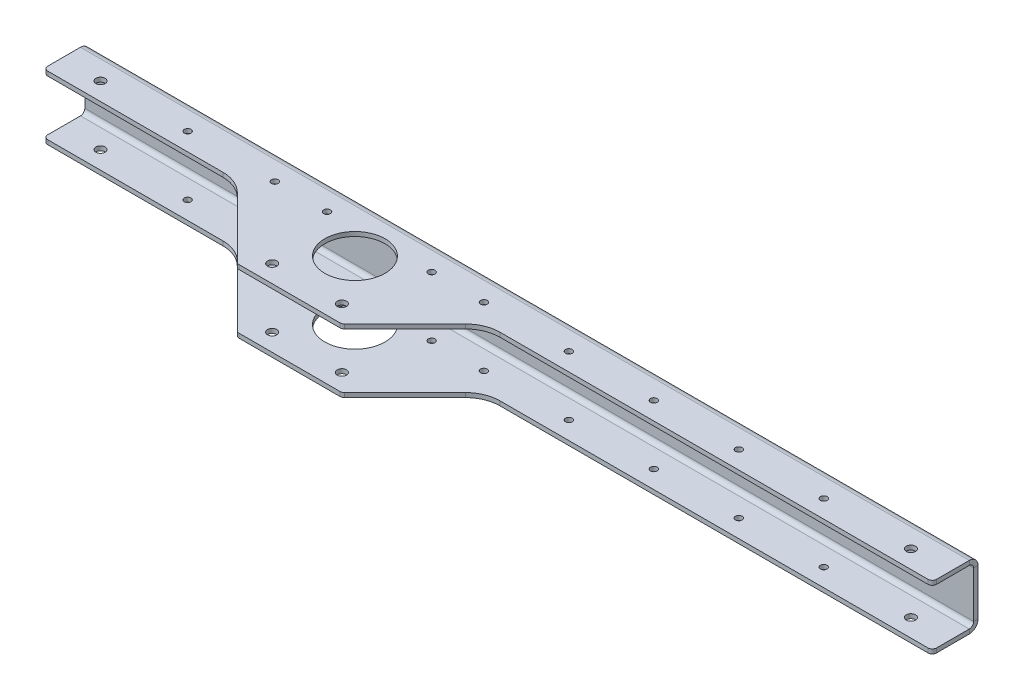
from build123d import *

# Parameters (mm, degrees)
BASE_FLANGE1_DEPTH = 647.7
SKETCH6_R          = 21.9075
CUT_EXTRUDE1_DEPTH = 655.999726679
CUT_EXTRUDE2_DEPTH = 655.999726679
SKETCH8_R          = 3.3782
SKETCH8_R_2        = 2.4257
CUT_EXTRUDE3_DEPTH = 655.999726679
SKETCH9_R          = 3.3782
CUT_EXTRUDE4_DEPTH = 655.999726679
FILLET1_R          = 25.4
FILLET2_R          = 3.175


# Sheet-metal steps are written as plain solids
with BuildPart() as part:
    # Sketch1 → Base-Flange1 (new body)
    with BuildSketch(Plane(origin=(0, 0, 0), x_dir=(0, 0, -1), z_dir=(1, 0, 0))):
        with BuildLine():
            Line((0, 0), (79.375, 0))
            ThreePointArc((79.375, 0), (81.62006403, 0.92993597), (82.55, 3.175))
            Line((82.55, 3.175), (82.55, 36.957))
            ThreePointArc((82.55, 36.957), (81.62006403, 39.20206403), (79.375, 40.132))
            Line((79.375, 40.132), (0, 40.132))
            Line((0, 40.132), (0, 43.307))
            Line((0, 43.307), (79.375, 43.307))
            ThreePointArc((79.375, 43.307), (83.865128061, 41.447128061), (85.725, 36.957))
            Line((85.725, 36.957), (85.725, 3.175))
            ThreePointArc((85.725, 3.175), (83.865128061, -1.315128061), (79.375, -3.175))
            Line((79.375, -3.175), (0, -3.175))
            Line((0, -3.175), (0, 0))
        make_face()
    extrude(amount=BASE_FLANGE1_DEPTH)

    # Sketch6 → Cut-Extrude1 (cut, through all)
    with BuildSketch(Plane(origin=(0, 43.307, 0), x_dir=(1, 0, 0), z_dir=(0, 1, 0))):
        with Locations(Location((231.775, 47.625, 0), (0, 0, 270))):
            Circle(SKETCH6_R)
    extrude(amount=-CUT_EXTRUDE1_DEPTH, mode=Mode.SUBTRACT)

    # Sketch7 → Cut-Extrude2 (cut, through all)
    with BuildSketch(Plane(origin=(0, 43.307, 0), x_dir=(1, 0, 0), z_dir=(0, 1, 0))):
        Polygon((141.2748, 52.4002), (0, 52.4002), (0, 0), (193.675, 0), align=None)
        Polygon((322.2752, 52.4002), (269.875, 0), (647.7, 0), (647.7, 52.4002), align=None)
    extrude(amount=-CUT_EXTRUDE2_DEPTH, mode=Mode.SUBTRACT)

    # Sketch8 → Cut-Extrude3 (cut, through all)
    with BuildSketch(Plane(origin=(0, 43.307, 0), x_dir=(1, 0, 0), z_dir=(0, 1, 0))):
        with Locations(Location((28.575, 65.405, 0), (0, 0, 270))):
            Circle(SKETCH8_R)
        with Locations(Location((92.075, 65.405, 0), (0, 0, 270))):
            Circle(SKETCH8_R_2)
        with Locations(Location((193.675, 65.405, 0), (0, 0, 270))):
            Circle(SKETCH8_R_2)
        with Locations(Location((269.875, 65.405, 0), (0, 0, 270))):
            Circle(SKETCH8_R_2)
        with Locations(Location((555.625, 65.405, 0), (0, 0, 270))):
            Circle(SKETCH8_R_2)
        with Locations(Location((619.125, 65.405, 0), (0, 0, 270))):
            Circle(SKETCH8_R)
        with Locations(Location((155.575, 65.405, 0), (0, 0, 270))):
            Circle(SKETCH8_R_2)
        with Locations(Location((307.975, 65.405, 0), (0, 0, 270))):
            Circle(SKETCH8_R_2)
        with Locations(Location((493.7125, 65.405, 0), (0, 0, 270))):
            Circle(SKETCH8_R_2)
        with Locations(Location((431.8, 65.405, 0), (0, 0, 270))):
            Circle(SKETCH8_R_2)
        with Locations(Location((369.8875, 65.405, 0), (0, 0, 270))):
            Circle(SKETCH8_R_2)
    extrude(amount=-CUT_EXTRUDE3_DEPTH, mode=Mode.SUBTRACT)

    # Sketch9 → Cut-Extrude4 (cut, through all)
    with BuildSketch(Plane(origin=(0, 43.307, 0), x_dir=(1, 0, 0), z_dir=(0, 1, 0))):
        with Locations(Location((257.175, 12.7, 0), (0, 0, 270))):
            Circle(SKETCH9_R)
        with Locations(Location((206.375, 12.7, 0), (0, 0, 270))):
            Circle(SKETCH9_R)
    extrude(amount=-CUT_EXTRUDE4_DEPTH, mode=Mode.SUBTRACT)

    # Fillet1
    fillet1_edges = [part.edges().sort_by_distance(p)[0] for p in [
        (141.2748, 41.7195, -52.4002),
        (141.2748, -1.5875, -52.4002),
        (322.2752, 41.7195, -52.4002),
        (322.2752, -1.5875, -52.4002),
    ]]
    fillet(fillet1_edges, radius=FILLET1_R)

    # Fillet2
    fillet2_edges = [part.edges().sort_by_distance(p)[0] for p in [
        (0, 41.7195, -52.4002),
        (193.675, 41.7195, 0),
        (193.675, -1.5875, 0),
        (0, -1.5875, -52.4002),
        (647.7, 41.7195, -52.4002),
        (269.875, 41.7195, 0),
        (647.7, -1.5875, -52.4002),
        (269.875, -1.5875, 0),
    ]]
    fillet(fillet2_edges, radius=FILLET2_R)


solid = part.part
